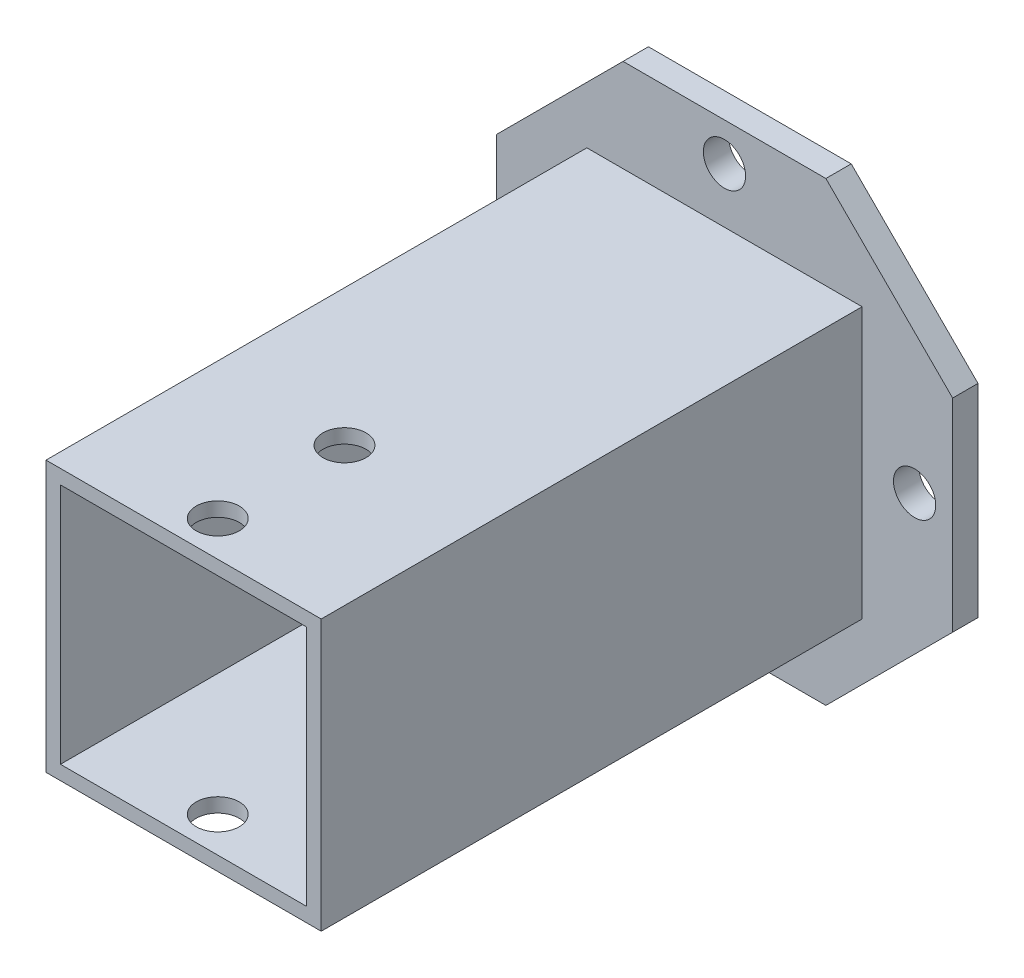
from build123d import *

# Parameters (mm, degrees)
SKETCH_1_W          = 28.4
SKETCH_1_H          = 28.4
EXTRUDE_1_DEPTH     = 3
SKETCH_2_R          = 1
CUT_EXTRUDE_1_DEPTH = 3
SKETCH_6_W          = 28.4
SKETCH_6_H          = 28.4
EXTRUDE_3_DEPTH     = 3
SKETCH_5_R          = 2.5
CUT_EXTRUDE_2_DEPTH = 3
SKETCH_7_W          = 32.565713714
SKETCH_7_H          = 32
SKETCH_7_W_2        = 29.140642766
SKETCH_7_H_2        = 28.634427506
EXTRUDE_4_DEPTH     = 73
SKETCH_8_W          = 9
SKETCH_8_H          = 32
CUT_EXTRUDE_3_DEPTH = 73
SKETCH_9_R          = 2.55
CUT_EXTRUDE_4_DEPTH = 73


with BuildPart() as part:
    # 草图1 → 凸台-拉伸1 (new body)
    with BuildSketch(Plane.XY):
        Rectangle(SKETCH_1_W, SKETCH_1_H)
    extrude(amount=EXTRUDE_1_DEPTH)

    # 草图2 → 切除-拉伸1 (cut)
    with BuildSketch(Plane.XY.offset(3)):
        Circle(SKETCH_2_R)
    extrude(amount=-CUT_EXTRUDE_1_DEPTH, mode=Mode.SUBTRACT)

    # 草图6 → 凸台-拉伸3 (add)
    with BuildSketch(Plane.XY.offset(3)):
        Polygon((27, 12), (12, 27), (-12, 27), (-27, 12), (-27, -12), (-12, -27), (12, -27), (27, -12), align=None)
        Rectangle(SKETCH_6_W, SKETCH_6_H, mode=Mode.SUBTRACT)
    extrude(amount=-EXTRUDE_3_DEPTH)

    # 草图5 → 切除-拉伸2 (cut)
    with BuildSketch(Plane(origin=(0, 0, 0), x_dir=(-1, 0, 0), z_dir=(0, 0, -1))):
        with Locations((0, 22.5)):
            Circle(SKETCH_5_R)
        with Locations((22.5, 0)):
            Circle(SKETCH_5_R)
        with Locations((-22.5, 0)):
            Circle(SKETCH_5_R)
        with Locations((0, -22.5)):
            Circle(SKETCH_5_R)
    extrude(amount=-CUT_EXTRUDE_2_DEPTH, mode=Mode.SUBTRACT)

    # 草图7 → 凸台-拉伸4 (add)
    with BuildSketch(Plane.XY.offset(3)):
        Rectangle(SKETCH_7_W, SKETCH_7_H)
        Rectangle(SKETCH_7_W_2, SKETCH_7_H_2, mode=Mode.SUBTRACT)
    extrude(amount=EXTRUDE_4_DEPTH)

    # 草图8 → 切除-拉伸3 (cut)
    with BuildSketch(Plane.ZY.offset(16.282856857)):
        with Locations((71.5, 0)):
            Rectangle(SKETCH_8_W, SKETCH_8_H)
    extrude(amount=-CUT_EXTRUDE_3_DEPTH, mode=Mode.SUBTRACT)

    # 草图9 → 切除-拉伸4 (cut)
    with BuildSketch(Plane.XZ.offset(16)):
        with Locations((-0.141428429, 62.82)):
            Circle(SKETCH_9_R)
        with Locations((-0.141428429, 47.82)):
            Circle(SKETCH_9_R)
    extrude(amount=-CUT_EXTRUDE_4_DEPTH, mode=Mode.SUBTRACT)


solid = part.part
